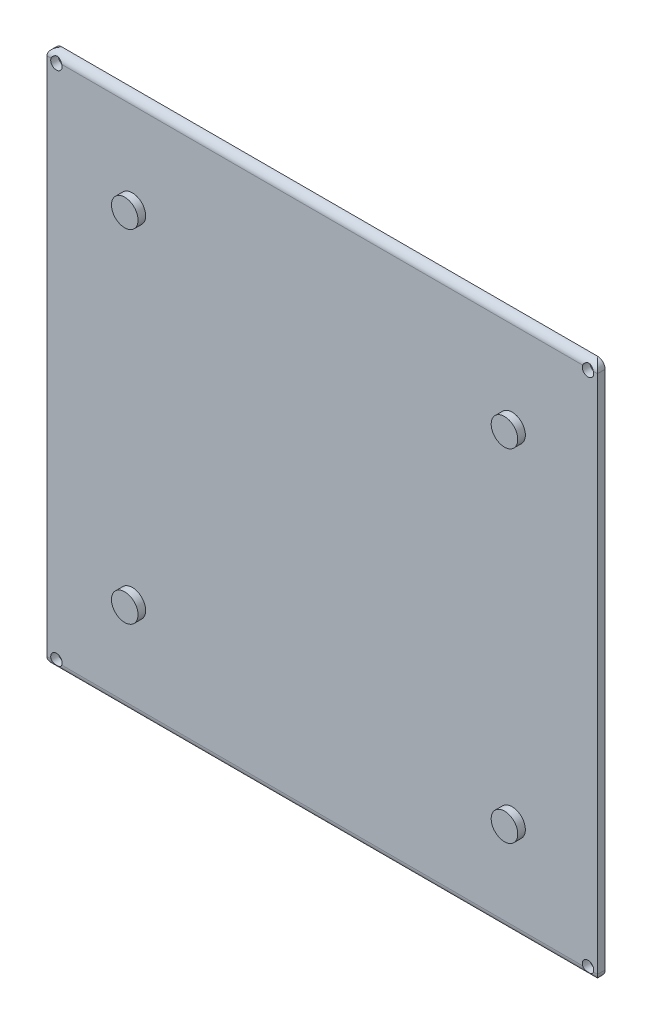
from build123d import *

# Parameters (mm, degrees)
SKETCH1_W                                  = 145
SKETCH1_H                                  = 141
BOSS_EXTRUDE1_DEPTH                        = 2
SKETCH2_R                                  = 1.5
CUT_EXTRUDE1_DEPTH                         = 5
FILLET1_R                                  = 2
SKETCH3_R                                  = 2.5
BOSS_EXTRUDE2_DEPTH                        = 5
FILLET2_R                                  = 2
SKETCH4_R                                  = 1.5
CUT_EXTRUDE2_DEPTH                         = 3
MIRROR1_AT_THE_SECOND_PLANE_COPY_1_SKETC_R = 1.5
MIRROR1_AT_THE_SECOND_PLANE_COPY_1_DEPTH   = 3
SKETCH5_R                                  = 3.5
BOSS_EXTRUDE3_DEPTH                        = 2
MIRROR2_AT_THE_SECOND_PLANE_COPY_1_SKETC_R = 3.5
MIRROR2_AT_THE_SECOND_PLANE_COPY_1_DEPTH   = 2


with BuildPart() as part:
    # Sketch1 → Boss-Extrude1 (new body)
    with BuildSketch(Plane.XY):
        Rectangle(SKETCH1_W, SKETCH1_H)
    extrude(amount=BOSS_EXTRUDE1_DEPTH)

    # Sketch2 → Cut-Extrude1 (cut)
    with BuildSketch(Plane.XY.offset(2)):
        with Locations((-70, 68)):
            Circle(SKETCH2_R)
        with Locations((-70, -68)):
            Circle(SKETCH2_R)
        with Locations((70, -68)):
            Circle(SKETCH2_R)
        with Locations((70, 68)):
            Circle(SKETCH2_R)
    extrude(amount=-CUT_EXTRUDE1_DEPTH, mode=Mode.SUBTRACT)

    # Fillet1
    # the kernel refuses this fillet: 2 mm, written as the material it takes off along each edge
    with BuildSketch(Plane(origin=(-77.5, 70.5, 2), x_dir=(0, -1, 0), z_dir=(1, 0, 0))) as fillet1_piece_1:
        with BuildLine():
            CenterArc((FILLET1_R, FILLET1_R), FILLET1_R, 180, 90)
            Line((0, FILLET1_R), (0, 0))
            Line((0, 0), (FILLET1_R, 0))
        make_face()
    extrude(amount=155, mode=Mode.SUBTRACT)
    with BuildSketch(Plane(origin=(-72.5, 70.5, -5), x_dir=(0, -1, 0), z_dir=(0, 0, 1)), Plane(origin=(-72.5, -70.5, -5), x_dir=(1, 0, 0), z_dir=(0, 0, 1))) as fillet1_piece_2:
        with BuildLine():
            CenterArc((FILLET1_R, FILLET1_R), FILLET1_R, 180, 90)
            Line((0, FILLET1_R), (0, 0))
            Line((0, 0), (FILLET1_R, 0))
        make_face()
    extrude(amount=12, mode=Mode.SUBTRACT)
    with BuildSketch(Plane(origin=(72.5, 70.5, -5), x_dir=(0, -1, 0), z_dir=(0, 0, 1)), Plane(origin=(72.5, -70.5, -5), x_dir=(-1, 0, 0), z_dir=(0, 0, 1))) as fillet1_piece_3:
        with BuildLine():
            CenterArc((FILLET1_R, -FILLET1_R), FILLET1_R, 90, 90)
            Line((0, -FILLET1_R), (0, 0))
            Line((0, 0), (FILLET1_R, 0))
        make_face()
    extrude(amount=12, mode=Mode.SUBTRACT)
    with BuildSketch(Plane(origin=(77.5, -70.5, 2), x_dir=(0, 0, -1), z_dir=(-1, 0, 0))) as fillet1_piece_4:
        with BuildLine():
            CenterArc((FILLET1_R, -FILLET1_R), FILLET1_R, 90, 90)
            Line((0, -FILLET1_R), (0, 0))
            Line((0, 0), (FILLET1_R, 0))
        make_face()
    extrude(amount=155, mode=Mode.SUBTRACT)

    # Sketch3 → Boss-Extrude2 (add)
    with BuildSketch(Plane(origin=(0, 0, 0), x_dir=(-1, 0, 0), z_dir=(0, 0, -1))):
        with Locations(Location((-48, 41.5, 0), (0, 0, 180))):
            Circle(SKETCH3_R)
        with Locations(Location((-48, -41.5, 0), (0, 0, 180))):
            Circle(SKETCH3_R)
        with Locations(Location((48, -41.5, 0), (0, 0, 180))):
            Circle(SKETCH3_R)
        with Locations(Location((48, 41.5, 0), (0, 0, 180))):
            Circle(SKETCH3_R)
    extrude(amount=BOSS_EXTRUDE2_DEPTH)

    # Fillet2
    fillet2_edges = [part.edges().sort_by_distance(p)[0] for p in [
        (45.5, 41.5, 0),
        (45.5, -41.5, 0),
        (-50.5, -41.5, 0),
        (-50.5, 41.5, 0),
    ]]
    fillet(fillet2_edges, radius=FILLET2_R)

    # Sketch4 → Cut-Extrude2 (cut)
    with BuildSketch(Plane(origin=(0, 0, -5), x_dir=(-1, 0, 0), z_dir=(0, 0, -1))):
        with Locations((-48, 41.5)):
            Circle(SKETCH4_R)
    cut_extrude2 = extrude(amount=-CUT_EXTRUDE2_DEPTH, mode=Mode.SUBTRACT)

    # Mirror1: Cut-Extrude2 across plane
    add(cut_extrude2.mirror(Plane(origin=(0, 0, 0), x_dir=(0, 0, 1), z_dir=(1, 0, 0))), mode=Mode.SUBTRACT)

    # Mirror1 at the second plane: Cut-Extrude2 across plane
    add(cut_extrude2.mirror(Plane.ZX), mode=Mode.SUBTRACT)

    # Mirror1 at the second plane copy 1 sketc → Mirror1 at the second plane copy 1 (cut)
    with BuildSketch(Plane(origin=(0, 0, -5), x_dir=(1, 0, 0), z_dir=(0, 0, -1))):
        with Locations((-48, 41.5)):
            Circle(MIRROR1_AT_THE_SECOND_PLANE_COPY_1_SKETC_R)
    extrude(amount=-MIRROR1_AT_THE_SECOND_PLANE_COPY_1_DEPTH, mode=Mode.SUBTRACT)

    # Sketch5 → Boss-Extrude3 (add)
    with BuildSketch(Plane.XY.offset(2)):
        with Locations((-50, 45)):
            Circle(SKETCH5_R)
    boss_extrude3 = extrude(amount=BOSS_EXTRUDE3_DEPTH)

    # Mirror2: Boss-Extrude3 across plane
    add(boss_extrude3.mirror(Plane(origin=(0, 0, 0), x_dir=(0, 0, 1), z_dir=(1, 0, 0))))

    # Mirror2 at the second plane: Boss-Extrude3 across plane
    add(boss_extrude3.mirror(Plane.ZX))

    # Mirror2 at the second plane copy 1 sketc → Mirror2 at the second plane copy 1 (add)
    with BuildSketch(Plane(origin=(0, 0, 2), x_dir=(-1, 0, 0), z_dir=(0, 0, 1))):
        with Locations((-50, 45)):
            Circle(MIRROR2_AT_THE_SECOND_PLANE_COPY_1_SKETC_R)
    extrude(amount=MIRROR2_AT_THE_SECOND_PLANE_COPY_1_DEPTH)


solid = part.part
